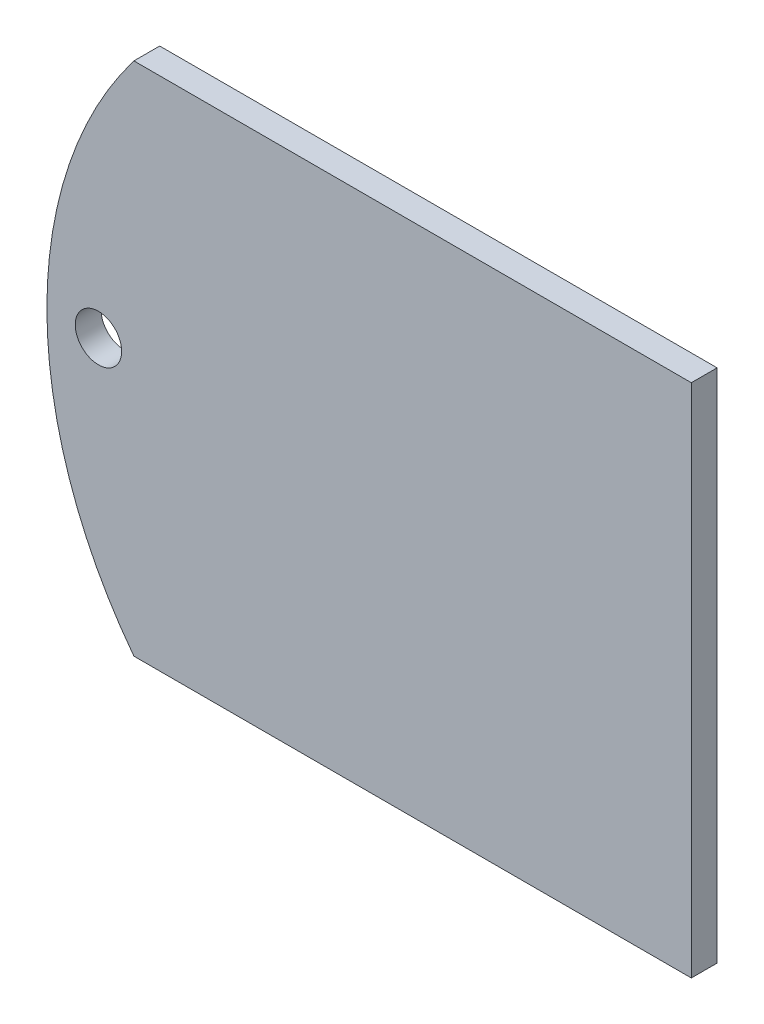
from build123d import *

# Parameters (mm, degrees)
CROQUIS1_R              = 1.8
SALIENTE_EXTRUIR1_DEPTH = 2


with BuildPart() as part:
    # Croquis1 → Saliente-Extruir1 (new body)
    with BuildSketch(Plane.XY):
        with BuildLine():
            ThreePointArc((-26.248809497, 20), (-33, 0), (-26.248809497, -20))
            Line((-26.248809497, -20), (17, -20))
            Line((17, -20), (17, 20))
            Line((17, 20), (-26.248809497, 20))
        make_face()
        with Locations((-29, 0)):
            Circle(CROQUIS1_R, mode=Mode.SUBTRACT)
    extrude(amount=SALIENTE_EXTRUIR1_DEPTH)


solid = part.part
